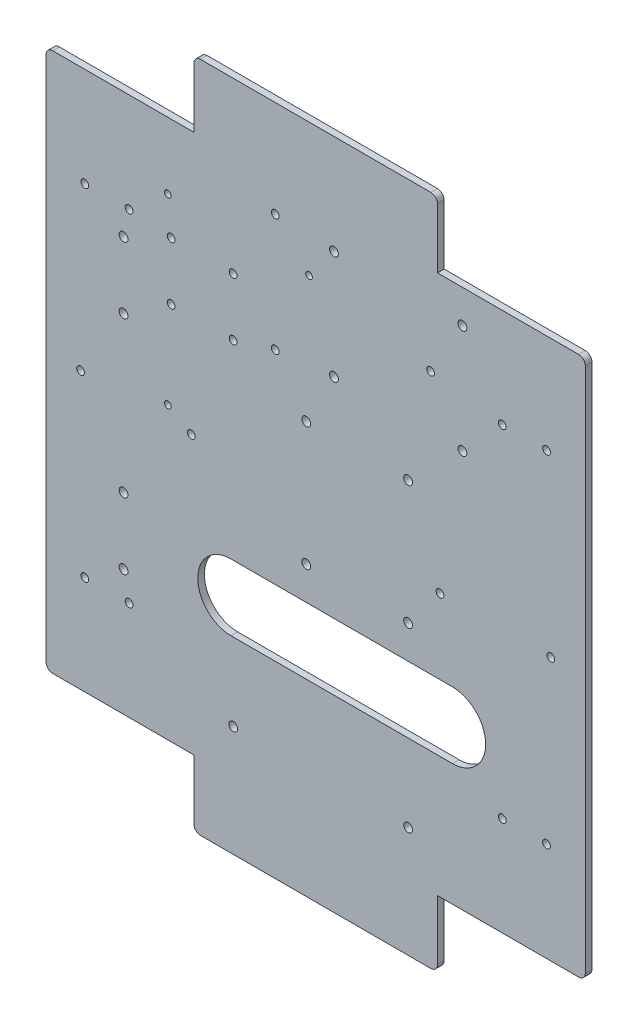
from build123d import *

# Parameters (mm, degrees)
BASE_DEPTH                       = 3
CONG_1_R                         = 3
ENL_V_MAT_EXTRU_1_DEPTH          = 383.50448595
CONG_2_R                         = 3
ESQUISSE33_R                     = 1.75
PERCAGE_MAIN_DE_DIEU_DEPTH       = 379.314954105
ESQUISSE26_R                     = 2
PERCAGE_BUCK_CONVERTER_DEPTH     = 379.314954105
ESQUISSE27_R                     = 2
PERCAGE_TEENSY_MOTEUR_DEPTH      = 379.314954105
ESQUISSE28_R                     = 1.5
PERCAGE_CARTE_ALIM_DEPTH         = 379.314954105
ESQUISSE29_R                     = 2
PERCAGE_RASP_DEPTH               = 379.314954105
ESQUISSE32_R                     = 1.75
PERCAGE_TEENSY_ACTIONNEURS_DEPTH = 379.314954105
ESQUISSE30_R                     = 2
PERCAGE_ALIM_ACTIONNEURS_DEPTH   = 379.314954105
ENL_V_MAT_EXTRU_7_DEPTH          = 379.314954105
ESQUISSE34_R                     = 1.75
ENL_V_MAT_EXTRU_10_DEPTH         = 379.314954105
ESQUISSE35_R                     = 1.75
ENL_V_MAT_EXTRU_11_DEPTH         = 379.314954105


with BuildPart() as part:
    # Esquisse1 → Base (new body)
    with BuildSketch(Plane.XY):
        Polygon((0, 0), (-200, 0), (-224.748737342, 24.748737342), (-224.748737342, 284.748737342), (-200, 309.497474683), (0, 309.497474683), (24.748737342, 284.748737342), (24.748737342, 24.748737342), align=None)
    extrude(amount=BASE_DEPTH)

    # Congé1
    cong_1_edges = [part.edges().sort_by_distance(p)[0] for p in [
        (-200, 0, 1.5),
        (-224.748737342, 24.748737342, 1.5),
        (-224.748737342, 284.748737342, 1.5),
        (-200, 309.497474683, 1.5),
        (0, 309.497474683, 1.5),
        (24.748737342, 284.748737342, 1.5),
        (24.748737342, 24.748737342, 1.5),
        (0, 0, 1.5),
    ]]
    fillet(cong_1_edges, radius=CONG_1_R)

    # Esquisse25 → Enlèv. mat.-Extru.1 (cut, through all)
    with BuildSketch(Plane(origin=(0, 0, 0), x_dir=(-1, 0, 0), z_dir=(0, 0, -1))):
        Polygon((-24.748737342, 33), (-24.748737342, 0), (45, 0), (155, 0), (224.748737342, 0), (224.748737342, 33), (224.748737342, 276.497474683), (224.748737342, 309.497474683), (155, 309.497474683), (45, 309.497474683), (-24.748737342, 309.497474683), (-24.748737342, 276.497474683), align=None)
        Polygon((-21.748737342, 33), (45, 33), (45, 3), (155, 3), (155, 33), (221.748737342, 33), (221.748737342, 276.497474683), (155, 276.497474683), (155, 306.497474683), (45, 306.497474683), (45, 276.497474683), (-21.748737342, 276.497474683), align=None, mode=Mode.SUBTRACT)
    extrude(amount=-ENL_V_MAT_EXTRU_1_DEPTH, mode=Mode.SUBTRACT)

    # Congé2
    cong_2_edges = [part.edges().sort_by_distance(p)[0] for p in [
        (21.748737342, 33, 1.5),
        (-45, 3, 1.5),
        (21.748737342, 276.497474683, 1.5),
        (-45, 306.497474683, 1.5),
        (-155, 306.497474683, 1.5),
        (-221.748737342, 276.497474683, 1.5),
        (-221.748737342, 33, 1.5),
        (-155, 3, 1.5),
    ]]
    fillet(cong_2_edges, radius=CONG_2_R)

    # Esquisse33 → Percage Main_De_Dieu (cut, through all)
    with BuildSketch(Plane.XY.offset(3)):
        with Locations((-204.248737342, 231.748737342)):
            Circle(ESQUISSE33_R)
        with Locations((-184.248737342, 231.748737342)):
            Circle(ESQUISSE33_R)
        with Locations((-204.248737342, 77.748737342)):
            Circle(ESQUISSE33_R)
        with Locations((-184.248737342, 77.748737342)):
            Circle(ESQUISSE33_R)
        with Locations((4.248737342, 77.748737342)):
            Circle(ESQUISSE33_R)
        with Locations((-15.751262658, 77.748737342)):
            Circle(ESQUISSE33_R)
        with Locations((4.248737342, 231.748737342)):
            Circle(ESQUISSE33_R)
        with Locations((-15.751262658, 231.748737342)):
            Circle(ESQUISSE33_R)
    extrude(amount=-PERCAGE_MAIN_DE_DIEU_DEPTH, mode=Mode.SUBTRACT)

    # Esquisse26 → Percage Buck Converter (cut, through all)
    with BuildSketch(Plane(origin=(0, 0, 0), x_dir=(-1, 0, 0), z_dir=(0, 0, -1))):
        with Locations((186.748737342, 189.748737342)):
            Circle(ESQUISSE26_R)
        with Locations((186.748737342, 219.748737342)):
            Circle(ESQUISSE26_R)
        with Locations((186.748737342, 89.748737342)):
            Circle(ESQUISSE26_R)
        with Locations((186.748737342, 119.748737342)):
            Circle(ESQUISSE26_R)
    extrude(amount=-PERCAGE_BUCK_CONVERTER_DEPTH, mode=Mode.SUBTRACT)

    # Esquisse27 → Percage Teensy Moteur (cut, through all)
    with BuildSketch(Plane(origin=(0, 0, 0), x_dir=(-1, 0, 0), z_dir=(0, 0, -1))):
        with Locations((137.251262658, 53)):
            Circle(ESQUISSE27_R)
        with Locations((58.251262658, 53)):
            Circle(ESQUISSE27_R)
    extrude(amount=-PERCAGE_TEENSY_MOTEUR_DEPTH, mode=Mode.SUBTRACT)

    # Esquisse28 → Percage Carte Alim (cut, through all)
    with BuildSketch(Plane(origin=(0, 0, 0), x_dir=(-1, 0, 0), z_dir=(0, 0, -1))):
        with Locations((166.748737342, 246.497474683)):
            Circle(ESQUISSE28_R)
        with Locations((102.998737342, 246.497474683)):
            Circle(ESQUISSE28_R)
        with Locations((166.748737342, 164.022474683)):
            Circle(ESQUISSE28_R)
    extrude(amount=-PERCAGE_CARTE_ALIM_DEPTH, mode=Mode.SUBTRACT)

    # Esquisse29 → Percage Rasp (cut, through all)
    with BuildSketch(Plane(origin=(0, 0, 0), x_dir=(-1, 0, 0), z_dir=(0, 0, -1))):
        with Locations((91.748737342, 212.497474683)):
            Circle(ESQUISSE29_R)
        with Locations((33.748737342, 212.497474683)):
            Circle(ESQUISSE29_R)
        with Locations((33.748737342, 261.497474683)):
            Circle(ESQUISSE29_R)
        with Locations((91.748737342, 261.497474683)):
            Circle(ESQUISSE29_R)
    extrude(amount=-PERCAGE_RASP_DEPTH, mode=Mode.SUBTRACT)

    # Esquisse32 → Percage Teensy Actionneurs (cut, through all)
    with BuildSketch(Plane.XY.offset(3)):
        with Locations((-118.251262658, 262.827474683)):
            Circle(ESQUISSE32_R)
        with Locations((-118.251262658, 209.827474683)):
            Circle(ESQUISSE32_R)
        with Locations((-48.111262658, 236.497474683)):
            Circle(ESQUISSE32_R)
    extrude(amount=-PERCAGE_TEENSY_ACTIONNEURS_DEPTH, mode=Mode.SUBTRACT)

    # Esquisse30 → Percage Alim Actionneurs (cut, through all)
    with BuildSketch(Plane(origin=(0, 0, 0), x_dir=(-1, 0, 0), z_dir=(0, 0, -1))):
        with Locations((104.251262658, 133)):
            Circle(ESQUISSE30_R)
        with Locations((58.251262658, 133)):
            Circle(ESQUISSE30_R)
        with Locations((58.251262658, 188.8)):
            Circle(ESQUISSE30_R)
        with Locations((104.251262658, 188.8)):
            Circle(ESQUISSE30_R)
    extrude(amount=-PERCAGE_ALIM_ACTIONNEURS_DEPTH, mode=Mode.SUBTRACT)

    # Esquisse31 → Enlèv. mat.-Extru.7 (cut, through all)
    with BuildSketch(Plane(origin=(0, 0, 0), x_dir=(-1, 0, 0), z_dir=(0, 0, -1))):
        with BuildLine():
            Line((138.251262658, 88), (38.251262658, 88))
            ThreePointArc((38.251262658, 88), (23.251262658, 103), (38.251262658, 118))
            Line((38.251262658, 118), (138.251262658, 118))
            ThreePointArc((138.251262658, 118), (153.251262658, 103), (138.251262658, 88))
        make_face()
    extrude(amount=-ENL_V_MAT_EXTRU_7_DEPTH, mode=Mode.SUBTRACT)

    # Esquisse34 → Enlèv. mat.-Extru.10 (cut, through all)
    with BuildSketch(Plane(origin=(0, 0, 0), x_dir=(-1, 0, 0), z_dir=(0, 0, -1))):
        with Locations((156.148737342, 157.748737342)):
            Circle(ESQUISSE34_R)
        with Locations((206.148737342, 157.748737342)):
            Circle(ESQUISSE34_R)
        with Locations((-6.148737342, 151.748737342)):
            Circle(ESQUISSE34_R)
        with Locations((43.851262658, 151.748737342)):
            Circle(ESQUISSE34_R)
    extrude(amount=-ENL_V_MAT_EXTRU_10_DEPTH, mode=Mode.SUBTRACT)

    # Esquisse35 → Enlèv. mat.-Extru.11 (cut, through all)
    with BuildSketch(Plane.XY.offset(3)):
        with Locations((-165.275776129, 230.07241249)):
            Circle(ESQUISSE35_R)
        with Locations((-137.275776129, 230.07241249)):
            Circle(ESQUISSE35_R)
        with Locations((-137.275776129, 204.07241249)):
            Circle(ESQUISSE35_R)
        with Locations((-165.275776129, 204.07241249)):
            Circle(ESQUISSE35_R)
    extrude(amount=-ENL_V_MAT_EXTRU_11_DEPTH, mode=Mode.SUBTRACT)


solid = part.part
